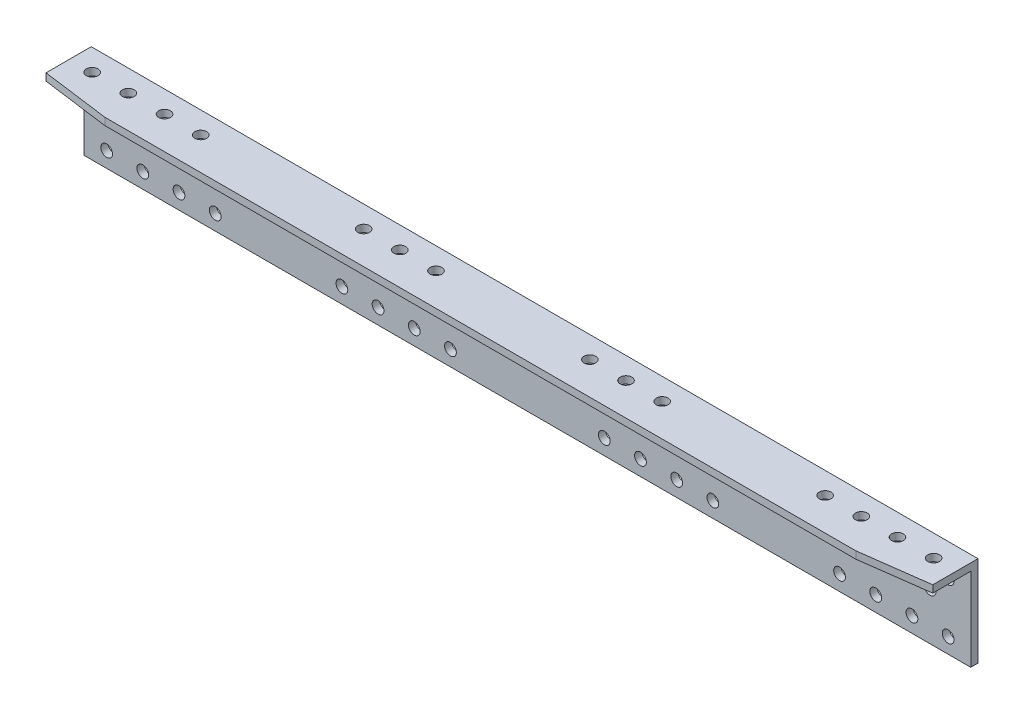
from build123d import *

# Parameters (mm, degrees)
SKETCH_1_W          = 1960
SKETCH_1_H          = 200
SKETCH_1_R          = 13
EXTRUDE_1545_DEPTH  = 16
SKETCH_2_W          = 1960
SKETCH_2_H          = 16
EXTRUDE_1_DEPTH     = 104
SKETCH_3_R          = 13
CUT_EXTRUDE_1_DEPTH = 1008.372820757


with BuildPart() as part:
    # 草图1 → Extrude 1545 (new body)
    with BuildSketch(Plane.XY):
        with Locations((0, 100)):
            Rectangle(SKETCH_1_W, SKETCH_1_H)
        with Locations((930, 146)):
            Circle(SKETCH_1_R, mode=Mode.SUBTRACT)
        with Locations((-890, 106)):
            Circle(SKETCH_1_R, mode=Mode.SUBTRACT)
        with Locations((850, 146)):
            Circle(SKETCH_1_R, mode=Mode.SUBTRACT)
        with Locations((930, 34)):
            Circle(SKETCH_1_R, mode=Mode.SUBTRACT)
        with Locations((850, 34)):
            Circle(SKETCH_1_R, mode=Mode.SUBTRACT)
        with Locations((-810, 106)):
            Circle(SKETCH_1_R, mode=Mode.SUBTRACT)
        with Locations((770, 34)):
            Circle(SKETCH_1_R, mode=Mode.SUBTRACT)
        with Locations((770, 146)):
            Circle(SKETCH_1_R, mode=Mode.SUBTRACT)
        with Locations((-730, 106)):
            Circle(SKETCH_1_R, mode=Mode.SUBTRACT)
        with Locations((690, 146)):
            Circle(SKETCH_1_R, mode=Mode.SUBTRACT)
        with Locations((690, 34)):
            Circle(SKETCH_1_R, mode=Mode.SUBTRACT)
        with Locations((-650, 106)):
            Circle(SKETCH_1_R, mode=Mode.SUBTRACT)
        with Locations((170, 146)):
            Circle(SKETCH_1_R, mode=Mode.SUBTRACT)
        with Locations((170, 34)):
            Circle(SKETCH_1_R, mode=Mode.SUBTRACT)
        with Locations((-410, 146)):
            Circle(SKETCH_1_R, mode=Mode.SUBTRACT)
        with Locations((250, 34)):
            Circle(SKETCH_1_R, mode=Mode.SUBTRACT)
        with Locations((250, 146)):
            Circle(SKETCH_1_R, mode=Mode.SUBTRACT)
        with Locations((-450, 106)):
            Circle(SKETCH_1_R, mode=Mode.SUBTRACT)
        with Locations((330, 34)):
            Circle(SKETCH_1_R, mode=Mode.SUBTRACT)
        with Locations((330, 146)):
            Circle(SKETCH_1_R, mode=Mode.SUBTRACT)
        with Locations((-370, 106)):
            Circle(SKETCH_1_R, mode=Mode.SUBTRACT)
        with Locations((-290, 106)):
            Circle(SKETCH_1_R, mode=Mode.SUBTRACT)
        with Locations((-210, 106)):
            Circle(SKETCH_1_R, mode=Mode.SUBTRACT)
        with Locations((890, 106)):
            Circle(SKETCH_1_R, mode=Mode.SUBTRACT)
        with Locations((810, 106)):
            Circle(SKETCH_1_R, mode=Mode.SUBTRACT)
        with Locations((650, 106)):
            Circle(SKETCH_1_R, mode=Mode.SUBTRACT)
        with Locations((730, 106)):
            Circle(SKETCH_1_R, mode=Mode.SUBTRACT)
        with Locations((-330, 146)):
            Circle(SKETCH_1_R, mode=Mode.SUBTRACT)
        with Locations((-330, 34)):
            Circle(SKETCH_1_R, mode=Mode.SUBTRACT)
        with Locations((410, 146)):
            Circle(SKETCH_1_R, mode=Mode.SUBTRACT)
        with Locations((-250, 146)):
            Circle(SKETCH_1_R, mode=Mode.SUBTRACT)
        with Locations((-250, 34)):
            Circle(SKETCH_1_R, mode=Mode.SUBTRACT)
        with Locations((450, 106)):
            Circle(SKETCH_1_R, mode=Mode.SUBTRACT)
        with Locations((-170, 34)):
            Circle(SKETCH_1_R, mode=Mode.SUBTRACT)
        with Locations((-170, 146)):
            Circle(SKETCH_1_R, mode=Mode.SUBTRACT)
        with Locations((370, 106)):
            Circle(SKETCH_1_R, mode=Mode.SUBTRACT)
        with Locations((-690, 146)):
            Circle(SKETCH_1_R, mode=Mode.SUBTRACT)
        with Locations((290, 106)):
            Circle(SKETCH_1_R, mode=Mode.SUBTRACT)
        with Locations((-770, 146)):
            Circle(SKETCH_1_R, mode=Mode.SUBTRACT)
        with Locations((210, 106)):
            Circle(SKETCH_1_R, mode=Mode.SUBTRACT)
        with Locations((-850, 146)):
            Circle(SKETCH_1_R, mode=Mode.SUBTRACT)
        with Locations((130, 106)):
            Circle(SKETCH_1_R, mode=Mode.SUBTRACT)
        with Locations((-930, 146)):
            Circle(SKETCH_1_R, mode=Mode.SUBTRACT)
        with Locations((-690, 34)):
            Circle(SKETCH_1_R, mode=Mode.SUBTRACT)
        with Locations((-770, 34)):
            Circle(SKETCH_1_R, mode=Mode.SUBTRACT)
        with Locations((-850, 34)):
            Circle(SKETCH_1_R, mode=Mode.SUBTRACT)
        with Locations((-930, 34)):
            Circle(SKETCH_1_R, mode=Mode.SUBTRACT)
        with Locations((-130, 106)):
            Circle(SKETCH_1_R, mode=Mode.SUBTRACT)
        with Locations((410, 34)):
            Circle(SKETCH_1_R, mode=Mode.SUBTRACT)
        with Locations((-410, 34)):
            Circle(SKETCH_1_R, mode=Mode.SUBTRACT)
    extrude(amount=EXTRUDE_1545_DEPTH)

    # 草图2 → 凸台-拉伸1 (add)
    with BuildSketch(Plane.XY.offset(16)):
        with Locations((0, 192)):
            Rectangle(SKETCH_2_W, SKETCH_2_H)
    extrude(amount=EXTRUDE_1_DEPTH)

    # 草图3 → 切除-拉伸1 (cut, through all)
    with BuildSketch(Plane(origin=(0, 200, 0), x_dir=(-1, 0, 0), z_dir=(0, 1, 0))):
        with Locations((-930, 48)):
            Circle(SKETCH_3_R)
        with Locations((-850, 48)):
            Circle(SKETCH_3_R)
        with Locations((-770, 48)):
            Circle(SKETCH_3_R)
        with Locations((-690, 48)):
            Circle(SKETCH_3_R)
        with Locations((-330, 48)):
            Circle(SKETCH_3_R)
        with Locations((-250, 48)):
            Circle(SKETCH_3_R)
        with Locations((-170, 48)):
            Circle(SKETCH_3_R)
        with Locations((170, 48)):
            Circle(SKETCH_3_R)
        with Locations((250, 48)):
            Circle(SKETCH_3_R)
        with Locations((330, 48)):
            Circle(SKETCH_3_R)
        with Locations((930, 48)):
            Circle(SKETCH_3_R)
        with Locations((850, 48)):
            Circle(SKETCH_3_R)
        with Locations((770, 48)):
            Circle(SKETCH_3_R)
        with Locations((690, 48)):
            Circle(SKETCH_3_R)
        Polygon((-980, 100), (-830, 120), (-980, 120), align=None)
        Polygon((980, 100), (830, 120), (980, 120), align=None)
    extrude(amount=-CUT_EXTRUDE_1_DEPTH, mode=Mode.SUBTRACT)


solid = part.part
